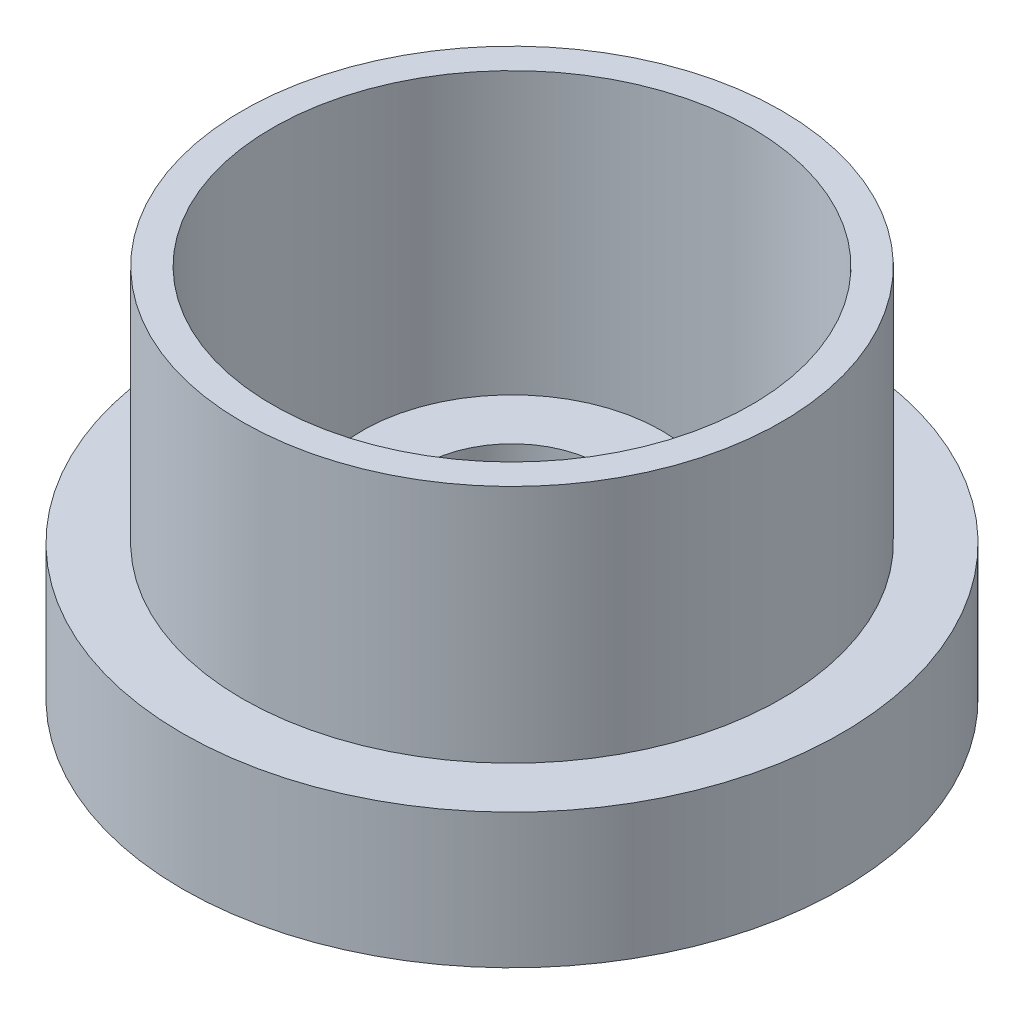
from build123d import *


with BuildPart() as part:
    # Esquisse1 → Base-Révolution (revolve)
    with BuildSketch(Plane.XY):
        Polygon((-6, 0), (-6, 10.5), (-10, 10.5), (-10, 5), (-16, 5), (-16, 25), (-18, 25), (-18, 9), (-22, 9), (-22, 0), align=None)
    revolve(axis=Axis((0, -75.104513541, 0), (0, 1, 0)))


solid = part.part
